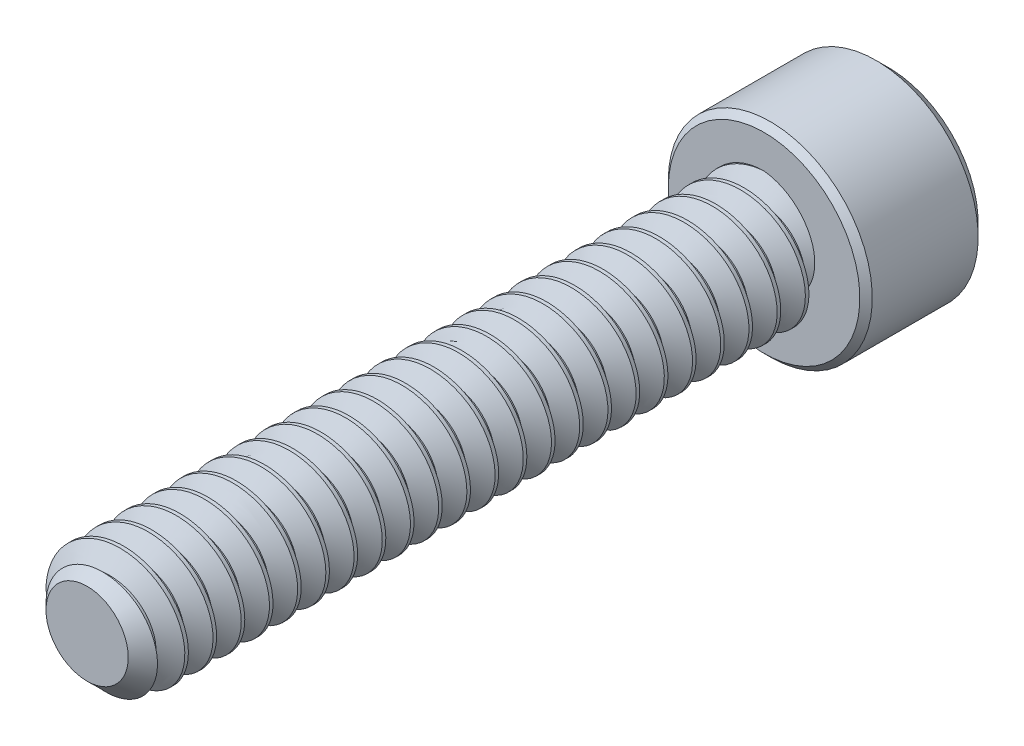
from build123d import *

# Parameters (mm, degrees)
SKETCH1_R          = 1.7526
EXTRUDE1_DEPTH     = 19.05
CHAMFER3_SIZE      = 0.5953125
CUT_SWEEP1_PITCH   = 0.79375
SKETCH6_R          = 2.8702
EXTRUDE2_DEPTH     = 3.5052
CUT_EXTRUDE1_DEPTH = 2.08359375
SKETCH8_R          = 1.603951217
CUT_EXTRUDE2_DEPTH = 0.35052
CUT_EXTRUDE2_DRAFT = -45
CHAMFER1_SIZE      = 0.35052
CHAMFER2_SIZE      = 0.17526


with BuildPart() as part:
    # Sketch1 → Extrude1 (new body)
    with BuildSketch(Plane.XY):
        Circle(SKETCH1_R)
    extrude(amount=-EXTRUDE1_DEPTH)

    # Chamfer3
    chamfer3_edges = [part.edges().sort_by_distance(p)[0] for p in [
        (-1.7526, 0, 0),
    ]]
    chamfer(chamfer3_edges, length=CHAMFER3_SIZE)

    # Cut-Sweep1: the profile of Sketch3 profile screwed along a right-hand helix of 25 turns, 6 arcs to a turn; built about Z, then put on its axis
    cut_sweep1_z = Axis((0, 0, 0), (0, 0, 1))
    cut_sweep1_corners = [(1.7529, 0, -0.694704455), (1.237044252, 0, -0.396875), (1.237044252, 0, -0.29765625), (1.7529, 0, 0.000173205)]
    with BuildLine(mode=Mode.PRIVATE) as cut_sweep1_profile:
        Line(cut_sweep1_corners[0], cut_sweep1_corners[1])
        Line(cut_sweep1_corners[1], cut_sweep1_corners[2])
        Line(cut_sweep1_corners[2], cut_sweep1_corners[3])
        Line(cut_sweep1_corners[3], cut_sweep1_corners[0])
    cut_sweep1_cap = Face(cut_sweep1_profile.wire())
    cut_sweep1_turn_angles = [0, 30, 60, 90, 120, 150, 180, 210, 240, 270, 300, 330, 360]
    cut_sweep1_turn_weights = [1, 0.8660254037844387, 1, 0.8660254037844387, 1, 0.8660254037844387, 1, 0.8660254037844387, 1, 0.8660254037844387, 1, 0.8660254037844387, 1]
    cut_sweep1_turn_rails = [Edge.make_bspline([Vector(p[0], p[1], 0).rotate(cut_sweep1_z, cut_sweep1_turn_angles[k]) / cut_sweep1_turn_weights[k] + Vector(0, 0, p[2] + CUT_SWEEP1_PITCH * cut_sweep1_turn_angles[k] / 360) for k in range(13)], [0, 0, 0, 1, 1, 2, 2, 3, 3, 4, 4, 5, 5, 6, 6, 6], 2, cut_sweep1_turn_weights) for p in cut_sweep1_corners]
    cut_sweep1_turn_sides = [Face.make_surface_from_curves(cut_sweep1_turn_rails[p[0]], cut_sweep1_turn_rails[p[1]]) for p in [(0, 1), (1, 2), (2, 3), (3, 0)]]
    cut_sweep1 = Plane(origin=(0, 0, 0), x_dir=(0, 1, 0), z_dir=(0, 0, -1)) * Solid(Shell([*[p.moved(Location((0, 0, CUT_SWEEP1_PITCH * i))) for i in range(25) for p in cut_sweep1_turn_sides], cut_sweep1_cap, cut_sweep1_cap.rotate(cut_sweep1_z, 9000).moved(Location((0, 0, CUT_SWEEP1_PITCH * 9000 / 360)))]))
    add(cut_sweep1, mode=Mode.SUBTRACT)

    # Sketch6 → Extrude2 (add)
    with BuildSketch(Plane(origin=(0, 0, -19.05), x_dir=(-1, 0, 0), z_dir=(0, 0, -1))):
        Circle(SKETCH6_R)
    extrude(amount=EXTRUDE2_DEPTH)

    # Sketch7 → Cut-Extrude1 (cut)
    with BuildSketch(Plane(origin=(0, 0, -22.5552), x_dir=(-1, 0, 0), z_dir=(0, 0, -1))):
        Polygon((0, 1.603951217), (-1.3890625, 0.801975608), (-1.3890625, -0.801975608), (0, -1.603951217), (1.3890625, -0.801975608), (1.3890625, 0.801975608), align=None)
    extrude(amount=-CUT_EXTRUDE1_DEPTH, mode=Mode.SUBTRACT)


with BuildPart() as cut_extrude2_tool:
    # Sketch8 → Cut-Extrude2 (with draft: the straight prism first)
    with BuildSketch(Plane(origin=(0, 0, -22.5552), x_dir=(-1, 0, 0), z_dir=(0, 0, -1))):
        Circle(SKETCH8_R)
    extrude(amount=-CUT_EXTRUDE2_DEPTH)
    # Cut-Extrude2: the draft: its side faces are tilted about the plane it starts from
    cut_extrude2_sides = [cut_extrude2_tool.faces().sort_by_distance(p)[0] for p in [
        (1.603951217, 0, -22.37994),
    ]]
    draft(cut_extrude2_sides, Plane(origin=(0, 0, -22.5552), x_dir=(-1, 0, 0), z_dir=(0, 0, -1)), CUT_EXTRUDE2_DRAFT)


with BuildPart() as part_1:
    add(part.part)

    # Cut-Extrude2: cut by cut_extrude2_tool
    add(cut_extrude2_tool.part, mode=Mode.SUBTRACT)

    # Chamfer1
    chamfer1_edges = [part_1.edges().sort_by_distance(p)[0] for p in [
        (2.8702, 0, -22.5552),
    ]]
    chamfer(chamfer1_edges, length=CHAMFER1_SIZE)

    # Chamfer2
    chamfer2_edges = [part_1.edges().sort_by_distance(p)[0] for p in [
        (2.8702, 0, -19.05),
    ]]
    chamfer(chamfer2_edges, length=CHAMFER2_SIZE)


solid = part_1.part
